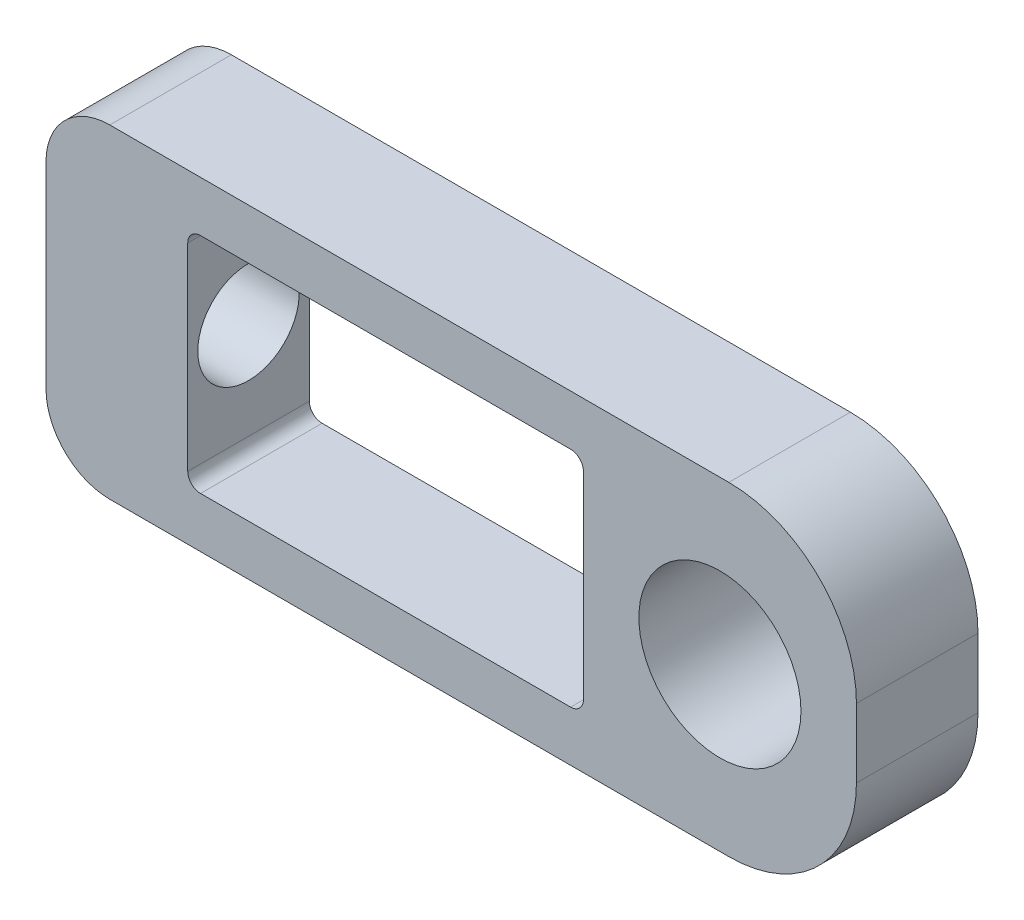
from build123d import *

# Parameters (mm, degrees)
SKETCH1_W           = 63.5
SKETCH1_H           = 25.4
BOSS_EXTRUDE1_DEPTH = 9.525
SKETCH5_R           = 6.35
SKETCH5_W           = 31
SKETCH5_H           = 17.5
CUT_EXTRUDE3_DEPTH  = 70.051688068
CUT_EXTRUDE2_REACH  = 71.052
SKETCH4_R           = 3.9751
FILLET4_R           = 10
FILLET5_R           = 5
FILLET6_R           = 1


with BuildPart() as part:
    # Sketch1 → Boss-Extrude1 (new body)
    with BuildSketch(Plane.XY):
        with Locations((31.75, 12.7)):
            Rectangle(SKETCH1_W, SKETCH1_H)
    extrude(amount=BOSS_EXTRUDE1_DEPTH)

    # Sketch5 → Cut-Extrude3 (cut, through all)
    with BuildSketch(Plane.XY.offset(9.525)):
        with Locations((52.803125, 12.7)):
            Circle(SKETCH5_R)
        with Locations((26.60625, 12.7)):
            Rectangle(SKETCH5_W, SKETCH5_H)
    extrude(amount=-CUT_EXTRUDE3_DEPTH, mode=Mode.SUBTRACT)

    # Sketch4 → Cut-Extrude2 (cut, up to next)
    with BuildSketch(Plane.ZY, mode=Mode.PRIVATE) as cut_extrude2_sk1:
        with Locations((4.7625, 12.7)):
            Circle(SKETCH4_R)
    cut_extrude2_tool1 = extrude(cut_extrude2_sk1.sketch, amount=-CUT_EXTRUDE2_REACH, mode=Mode.PRIVATE) & part.part
    add(cut_extrude2_tool1.solids().sort_by_distance((0, 12.7, 4.7625))[0], mode=Mode.SUBTRACT)

    # Fillet4
    fillet4_edges = [part.edges().sort_by_distance(p)[0] for p in [
        (63.5, 0, 4.7625),
        (63.5, 25.4, 4.7625),
    ]]
    fillet(fillet4_edges, radius=FILLET4_R)

    # Fillet5
    fillet5_edges = [part.edges().sort_by_distance(p)[0] for p in [
        (0, 0, 4.7625),
        (0, 25.4, 4.7625),
    ]]
    fillet(fillet5_edges, radius=FILLET5_R)

    # Fillet6
    fillet6_edges = [part.edges().sort_by_distance(p)[0] for p in [
        (11.10625, 21.45, 4.7625),
        (11.10625, 3.95, 4.7625),
        (42.10625, 3.95, 4.7625),
        (42.10625, 21.45, 4.7625),
    ]]
    fillet(fillet6_edges, radius=FILLET6_R)


solid = part.part
